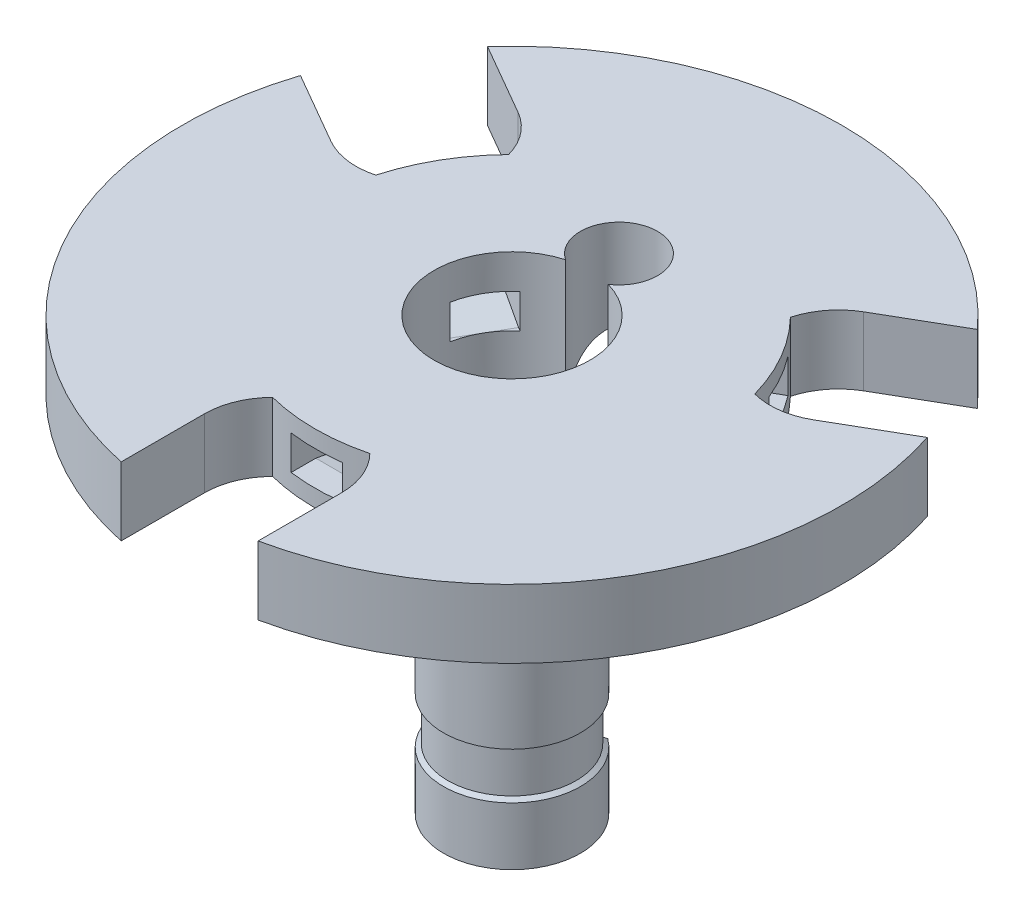
from build123d import *

# Parameters (mm, degrees)
BOSS_EXTRUDE1_DEPTH     = 4
SKETCH1_4_R             = 4
BOSS_EXTRUDE2_DEPTH     = 27.15
FILLET3_SIZE            = 7.5
FILLET3_SIZE_2          = 10
CUT_EXTRUDE1_START      = -1.932
SKETCH6_R               = 4
SKETCH6_R_2             = 3.356
CUT_EXTRUDE1_DEPTH      = 1.932
SKETCH8_R               = 2.5
CUT_EXTRUDE3_DEPTH      = 5
CHAMFER1_SIZE           = 2
CHAMFER1_SIZE2          = 0.727940469
CUT_EXTRUDE2_DEPTH      = 36.735801376
CUT_EXTRUDE2_DEPTH_BACK = 36.735801376
SKETCH7_R               = 2.25
SKETCH13_W              = 0.25
SKETCH13_H              = 2.75
CHAMFER4_SIZE           = 0.3
CHAMFER4_SIZE_2         = 0.210062261
SKETCH10_W              = 3
SKETCH10_H              = 2
CUT_EXTRUDE15_DEPTH     = 1.5
CIRPATTERN2_COUNT       = 3
CUT_EXTRUDE16_START     = -1.932
SKETCH14_R              = 3.356
SKETCH14_R_2            = 2.3
CUT_EXTRUDE16_DEPTH     = 1.932


with BuildPart() as part:
    # Sketch1 → Boss-Extrude1 (new body)
    with BuildSketch(Plane(origin=(0, 0, 0), x_dir=(1, 0, 0), z_dir=(0, 1, 0))):
        with BuildLine():
            Line((-14.089714637, 3.515898385), (-18.307111179, 5.950813414))
            ThreePointArc((-18.307111179, 5.950813414), (-16.670989023, -9.625), (-4, -18.829830058))
            Line((-4, -18.829830058), (-4, -13.96))
            ThreePointArc((-4, -13.96), (-3.698779414, -12.437163552), (-2.840484577, -11.143681948))
            ThreePointArc((-2.840484577, -11.143681948), (0, -11.5), (2.840484577, -11.143681948))
            ThreePointArc((2.840484577, -11.143681948), (3.698779414, -12.437163552), (4, -13.96))
            Line((4, -13.96), (4, -18.829830058))
            ThreePointArc((4, -18.829830058), (16.670989023, -9.625), (18.307111179, 5.950813414))
            Line((18.307111179, 5.950813414), (14.089714637, 3.515898385))
            ThreePointArc((14.089714637, 3.515898385), (12.620289295, 3.015344841), (11.070953948, 3.111909171))
            ThreePointArc((11.070953948, 3.111909171), (9.959292144, 5.75), (8.230469371, 8.031772777))
            ThreePointArc((8.230469371, 8.031772777), (8.92150988, 9.421818712), (10.089714637, 10.444101615))
            Line((10.089714637, 10.444101615), (14.307111179, 12.879016644))
            ThreePointArc((14.307111179, 12.879016644), (0, 19.25), (-14.307111179, 12.879016644))
            Line((-14.307111179, 12.879016644), (-10.089714637, 10.444101615))
            ThreePointArc((-10.089714637, 10.444101615), (-8.92150988, 9.421818712), (-8.230469371, 8.031772777))
            ThreePointArc((-8.230469371, 8.031772777), (-9.959292144, 5.75), (-11.070953948, 3.111909171))
            ThreePointArc((-11.070953948, 3.111909171), (-12.620289295, 3.015344841), (-14.089714637, 3.515898385))
        make_face()
    extrude(amount=-BOSS_EXTRUDE1_DEPTH)

    # Sketch1<4> → Boss-Extrude2 (add)
    with BuildSketch(Plane(origin=(0, 0, 0), x_dir=(1, 0, 0), z_dir=(0, 1, 0))):
        with Locations(Location((0, 0, 0), (0, 0, 270))):
            Circle(SKETCH1_4_R)
    extrude(amount=-BOSS_EXTRUDE2_DEPTH)

    # Sketch2 → Cut-Revolve4 (revolve, cut)
    with BuildSketch(Plane(origin=(0, 0, 0), x_dir=(0, 0, -1), z_dir=(1, 0, 0)), mode=Mode.PRIVATE) as cut_revolve4_sk:
        Polygon((0, -27.15), (2.3, -27.15), (2.3, -25.15), (2.5, 0), (0, 0), align=None)
    revolve(cut_revolve4_sk.sketch.rotate(Axis((0, 0, 0), (0, -1, 0)), 180), axis=Axis((0, 0, 0), (0, -1, 0)), mode=Mode.SUBTRACT)

    # Fillet3
    # an asymmetric fillet: 10, 7.5 mm, written as the material it adds along each edge
    with BuildSketch(Plane(origin=(0, -4, 0), x_dir=(0, 0, 1), z_dir=(-1, 0, 0))) as fillet3_piece_1_section:
        with BuildLine():
            Bezier((4 + FILLET3_SIZE, 0), (4, 0), (4, -FILLET3_SIZE_2), weights=[1, 0.707106781, 1])
            Line((4, -FILLET3_SIZE_2), (4, 0))
            Line((4, 0), (4 + FILLET3_SIZE, 0))
        make_face()
    fillet3_piece_1 = revolve(axis=Axis((0, -4, 0), (0, 1, 0)), mode=Mode.PRIVATE)
    fillet3_piece_1 = fillet3_piece_1 & Plane(origin=(0, -3.929777006, 0), x_dir=(-0.7156929887401748, 0, -0.6984150240853615), z_dir=(0, 1, 0)) * Cylinder(11.5, 46, mode=Mode.PRIVATE)
    add(fillet3_piece_1)

    # Sketch5 → Cut-Revolve8 (revolve, cut)
    with BuildSketch(Plane.XY, mode=Mode.PRIVATE) as cut_revolve8_sk:
        Polygon((0, -7), (0, -9.309401077), (-4.55, -6.682457352), (-4.55, 0), (-2.55, 0), (-2.55, -5.527756814), align=None)
        Polygon((0, 0), (0, -7), (-2.55, -5.527756814), (-2.55, 0), align=None)
    revolve(cut_revolve8_sk.sketch.rotate(Axis((0, 0, 0), (0, -1, 0)), 270), axis=Axis((0, 0, 0), (0, -1, 0)), mode=Mode.SUBTRACT)

    # Sketch6 → Cut-Extrude1 (cut)
    with BuildSketch(Plane.XZ.offset(27.15).offset(CUT_EXTRUDE1_START)):
        with Locations(Location((0, 0, 0), (0, 0, 90))):
            Circle(SKETCH6_R)
        with Locations(Location((0, 0, 0), (0, 0, 270))):
            Circle(SKETCH6_R_2, mode=Mode.SUBTRACT)
    extrude(amount=CUT_EXTRUDE1_DEPTH, mode=Mode.SUBTRACT)

    # Sketch8 → Cut-Extrude3 (cut)
    with BuildSketch(Plane(origin=(0, -23, 0), x_dir=(1, 0, 0), z_dir=(0, 1, 0))):
        with Locations((0, 4)):
            Circle(SKETCH8_R)
    extrude(amount=CUT_EXTRUDE3_DEPTH, mode=Mode.SUBTRACT)

    # Chamfer1
    chamfer1_edges = [part.edges().sort_by_distance(p)[0] for p in [
        (0, -18, -4),
    ]]
    chamfer1_side = [part.faces().sort_by_distance(p)[0] for p in [
        (0, -19.609, -4),
    ]]
    chamfer(chamfer1_edges, length=CHAMFER1_SIZE, length2=CHAMFER1_SIZE2, reference=chamfer1_side[0])

    # Sketch7 → Cut-Extrude2 (cut, two sides: drawn at the far end of the back side and taken through both)
    with BuildSketch(Plane.XZ.offset(4).offset(-CUT_EXTRUDE2_DEPTH_BACK)):
        with Locations(Location((0, -6.25, 0), (0, 0, 56.387449327))):
            Circle(SKETCH7_R)
    extrude(amount=CUT_EXTRUDE2_DEPTH + CUT_EXTRUDE2_DEPTH_BACK, mode=Mode.SUBTRACT)

    # Sketch13 → Cut-Revolve14 (revolve, cut)
    with BuildSketch(Plane(origin=(0, 0, 0), x_dir=(0, 0, -1), z_dir=(1, 0, 0)), mode=Mode.PRIVATE) as cut_revolve14_sk:
        with Locations((-3.875, -20.5)):
            Rectangle(SKETCH13_W, SKETCH13_H)
    revolve(cut_revolve14_sk.sketch.rotate(Axis((0, -7.902306907, 0), (0, -1, 0)), 216.419913729), axis=Axis((0, -7.902306907, 0), (0, -1, 0)), mode=Mode.SUBTRACT)

    # Chamfer4
    # the kernel refuses this chamfer: 0.3, 0.210062261 mm, written as the material it adds along each edge
    with BuildSketch(Plane(origin=(0, -21.875, 0), x_dir=(0.43172798800380885, 0, -0.9020038494231514), z_dir=(-0.9020038494231514, 0, -0.43172798800380885))) as chamfer4_piece_1_section:
        Polygon((3.75 + CHAMFER4_SIZE, 0), (3.75, -CHAMFER4_SIZE_2 * 1.0000000022), (3.75, 0), align=None)
    chamfer4_piece_1 = revolve(axis=Axis((0, -21.875, 0), (0, -1, 0)), revolution_arc=308.845454641, mode=Mode.PRIVATE)
    chamfer4_piece_1 = chamfer4_piece_1 & Plane(origin=(0, -21.756112084, 0), x_dir=(0, 0, 1), z_dir=(0, 1, 0)) * Cylinder(4, 17, mode=Mode.PRIVATE)
    chamfer4_piece_1 = chamfer4_piece_1 - Plane(origin=(0, -21.756112084, -4), x_dir=(1, 0, 0), z_dir=(0, -1, 0)) * Cylinder(2.5, 17, mode=Mode.PRIVATE)
    add(chamfer4_piece_1)

    # Sketch10 → Cut-Extrude15 (cut, symmetric)
    with BuildSketch(Plane(origin=(0, 0, 0), x_dir=(0, 0, -1), z_dir=(1, 0, 0))):
        with Locations((-11.46, -2)):
            Rectangle(SKETCH10_W, SKETCH10_H)
        Polygon((-4.55, -4), (-9.96, -3), (-9.96, -1), (-4.55, -2), align=None)
        with Locations((-3.05, -3)):
            Rectangle(SKETCH10_W, SKETCH10_H)
    cut_extrude15 = extrude(amount=CUT_EXTRUDE15_DEPTH, both=True, mode=Mode.SUBTRACT)

    # CirPattern2: Cut-Extrude15 ×3 about axis
    cirpattern2_axis = Axis((0, 0, 0), (0, 1, 0))
    for i in range(1, CIRPATTERN2_COUNT):
        add(cut_extrude15.rotate(cirpattern2_axis, i * 360 / CIRPATTERN2_COUNT), mode=Mode.SUBTRACT)

    # Sketch14 → Cut-Extrude16 (cut)
    with BuildSketch(Plane.XZ.offset(27.15).offset(CUT_EXTRUDE16_START)):
        Circle(SKETCH14_R)
        with Locations(Location((0, 0, 0), (0, 0, 90))):
            Circle(SKETCH14_R_2, mode=Mode.SUBTRACT)
    extrude(amount=CUT_EXTRUDE16_DEPTH, mode=Mode.SUBTRACT)


solid = part.part
